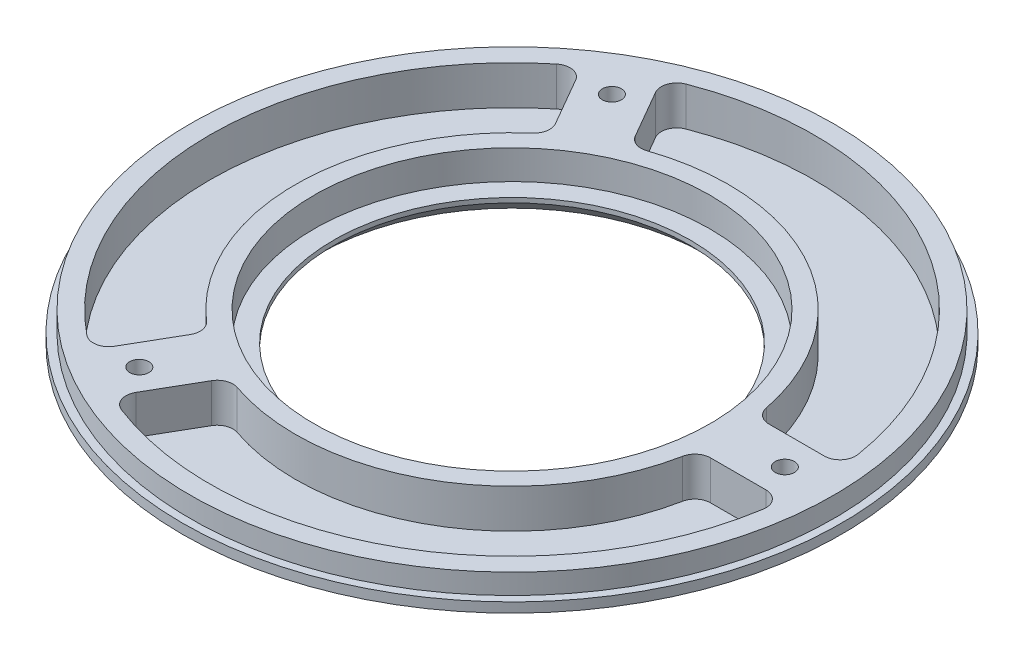
from build123d import *

# Parameters (mm, degrees)
F_90_0_0087_DIAMETER_HOLE1_D                        = 0.22098
CIRPATTERN3_COUNT                                   = 3
CUT_EXTRUDE1_DEPTH                                  = 10
FILLET1_R                                           = 4
CIRPATTERN4_COUNT                                   = 3
FILLET1_OF_CIRPATTERN4_R                            = 4
CHAMFER1_SIZE                                       = 4
BOSS_EXTRUDE1_START                                 = -7.5
SKETCH10_R                                          = 84.55
SKETCH10_R_2                                        = 82.55
BOSS_EXTRUDE1_DEPTH                                 = 7.5
CHAMFER3_SIZE                                       = 5
CHAMFER3_SIZE2                                      = 8.660254038
FILLET4_R                                           = 5
CBORE_FOR_10_BINDING_HEAD_MACHINE_SCREW_D           = 4.9149
CBORE_FOR_10_BINDING_HEAD_MACHINE_SCREW_CBORE_D     = 9.525
CBORE_FOR_10_BINDING_HEAD_MACHINE_SCREW_CBORE_DEPTH = 2.794
CIRPATTERN5_COUNT                                   = 3


with BuildPart() as part:
    # Sketch2 → Revolve1 (revolve)
    with BuildSketch(Plane(origin=(0, 0, 0), x_dir=(0, 0, -1), z_dir=(1, 0, 0))):
        Polygon((-45.8, 0), (-82.55, 0), (-82.55, 12.7), (-50.8, 12.7), (-50.8, 5.2), (-45.8, 5.2), align=None)
    revolve(axis=Axis((0, -0.635, 0), (0, 1, 0)))

    # #90 (0.0087) Diameter Hole1 (through all)
    with Locations(Plane(origin=(0, 12.7, 0), x_dir=(1, 0, 0), z_dir=(0, 1, 0))):
        with Locations((-35, 60.621778265)):
            f_90_0_0087_diameter_hole1 = Hole(F_90_0_0087_DIAMETER_HOLE1_D / 2)

    # CirPattern3: #90 (0.0087) Diameter Hole1 ×3 about axis
    cirpattern3_axis = Axis((0, -0.635, 0), (0, 1, 0))
    for i in range(1, CIRPATTERN3_COUNT):
        add(f_90_0_0087_diameter_hole1.rotate(cirpattern3_axis, i * 360 / CIRPATTERN3_COUNT), mode=Mode.SUBTRACT)

    # Sketch8 → Cut-Extrude1 (cut)
    with BuildSketch(Plane(origin=(0, 12.7, 0), x_dir=(1, 0, 0), z_dir=(0, 1, 0))):
        with BuildLine():
            Line((-21.025494874, 51.417225376), (-32.098048841, 70.595451416))
            ThreePointArc((-32.098048841, 70.595451416), (38.775, 67.160270063), (77.186478738, 7.5))
            Line((77.186478738, 7.5), (55.041370804, 7.5))
            ThreePointArc((55.041370804, 7.5), (27.775, 48.10771118), (-21.025494874, 51.417225376))
        make_face()
    cut_extrude1 = extrude(amount=-CUT_EXTRUDE1_DEPTH, mode=Mode.SUBTRACT)

    # Fillet1
    fillet1_edges = [part.edges().sort_by_distance(p)[0] for p in [
        (-21.025494874, 7.7, -51.417225376),
        (55.041370804, 7.7, -7.5),
        (77.186478738, 7.7, -7.5),
        (-32.098048841, 7.7, -70.595451416),
    ]]
    fillet(fillet1_edges, radius=FILLET1_R)

    # CirPattern4: Cut-Extrude1 ×3 about axis
    cirpattern4_axis = Axis((0, -0.635, 0), (0, 1, 0))
    for i in range(1, CIRPATTERN4_COUNT):
        add(cut_extrude1.rotate(cirpattern4_axis, i * 360 / CIRPATTERN4_COUNT), mode=Mode.SUBTRACT)

    # Fillet1 of CirPattern4
    fillet1_of_cirpattern4_edges = [part.edges().sort_by_distance(p)[0] for p in [
        (-34.01587593, 7.7, 43.917225376),
        (-34.01587593, 7.7, -43.917225376),
        (-45.088429897, 7.7, -63.095451416),
        (-45.088429897, 7.7, 63.095451416),
        (55.041370804, 7.7, 7.5),
        (-21.025494874, 7.7, 51.417225376),
        (-32.098048841, 7.7, 70.595451416),
        (77.186478738, 7.7, 7.5),
    ]]
    fillet(fillet1_of_cirpattern4_edges, radius=FILLET1_OF_CIRPATTERN4_R)

    # Chamfer1
    chamfer1_edges = [part.edges().sort_by_distance(p)[0] for p in [
        (0, 0, -45.8),
    ]]
    chamfer(chamfer1_edges, length=CHAMFER1_SIZE)

    # Sketch10 → Boss-Extrude1 (add)
    with BuildSketch(Plane.XZ.offset(BOSS_EXTRUDE1_START)):
        Circle(SKETCH10_R)
        Circle(SKETCH10_R_2, mode=Mode.SUBTRACT)
    extrude(amount=BOSS_EXTRUDE1_DEPTH)

    # Chamfer3
    chamfer3_edges = [part.edges().sort_by_distance(p)[0] for p in [
        (-84.55, 0, 0),
    ]]
    chamfer3_side = [part.faces().sort_by_distance(p)[0] for p in [
        (-84.55, 3.75, 0),
    ]]
    chamfer(chamfer3_edges, length=CHAMFER3_SIZE, length2=CHAMFER3_SIZE2, reference=chamfer3_side[0])

    # Fillet4
    fillet4_edges = [part.edges().sort_by_distance(p)[0] for p in [
        (-75.889745962, 0, 0),
    ]]
    fillet(fillet4_edges, radius=FILLET4_R)

    # CBORE for #10 Binding Head Machine Screw1 (through all)
    with Locations(Plane(origin=(0, 0, 0), x_dir=(-1, 0, 0), z_dir=(0, -1, 0))):
        with Locations((35, 60.621778265)):
            cbore_for_10_binding_head_machine_screw = CounterBoreHole(CBORE_FOR_10_BINDING_HEAD_MACHINE_SCREW_D / 2, CBORE_FOR_10_BINDING_HEAD_MACHINE_SCREW_CBORE_D / 2, CBORE_FOR_10_BINDING_HEAD_MACHINE_SCREW_CBORE_DEPTH)

    # CirPattern5: CBORE for #10 Binding Head Machine Screw1 ×3 about axis
    cirpattern5_axis = Axis((0, -0.635, 0), (0, 1, 0))
    for i in range(1, CIRPATTERN5_COUNT):
        add(cbore_for_10_binding_head_machine_screw.rotate(cirpattern5_axis, i * 360 / CIRPATTERN5_COUNT), mode=Mode.SUBTRACT)


solid = part.part
